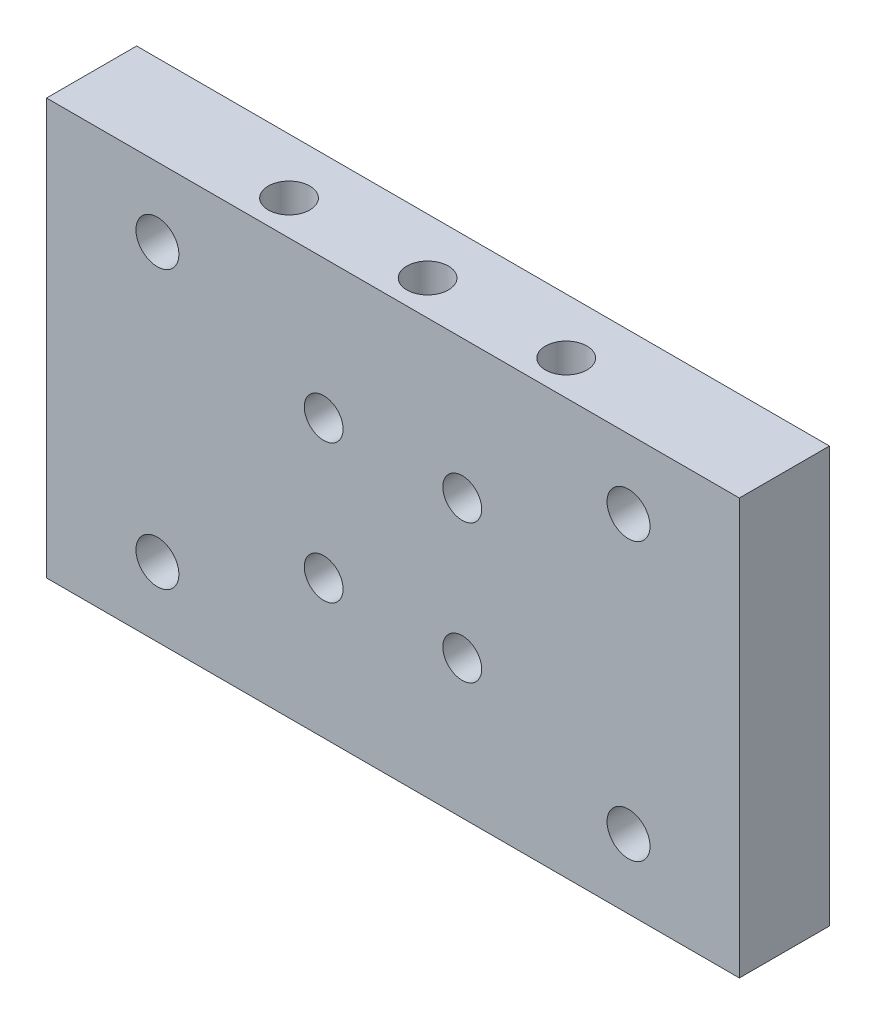
from build123d import *

# Parameters (mm, degrees)
SKETCH_1_W          = 50
SKETCH_1_H          = 30
EXTRUDE_1_DEPTH     = 6.5
SKETCH_2_R          = 1.4
CUT_EXTRUDE_1_DEPTH = 30.870554062
SKETCH_4_R          = 1.55
CUT_EXTRUDE_2_DEPTH = 30.870554062
SKETCH_5_R          = 1.5
CUT_EXTRUDE_3_DEPTH = 40.588508434


with BuildPart() as part:
    # 草图1 → 凸台-拉伸1 (new body)
    with BuildSketch(Plane.XY):
        Rectangle(SKETCH_1_W, SKETCH_1_H)
    extrude(amount=EXTRUDE_1_DEPTH)

    # 草图2 → 切除-拉伸1 (cut, through all)
    with BuildSketch(Plane.XY.offset(6.5)):
        with Locations((-5, -5)):
            Circle(SKETCH_2_R)
        with Locations((5, -5)):
            Circle(SKETCH_2_R)
        with Locations((-5, 5)):
            Circle(SKETCH_2_R)
        with Locations((5, 5)):
            Circle(SKETCH_2_R)
    extrude(amount=-CUT_EXTRUDE_1_DEPTH, mode=Mode.SUBTRACT)

    # 草图4 → 切除-拉伸2 (cut, through all)
    with BuildSketch(Plane(origin=(0, 0, 0), x_dir=(-1, 0, 0), z_dir=(0, 0, -1))):
        with Locations((-17, 10)):
            Circle(SKETCH_4_R)
        with Locations((-17, -10)):
            Circle(SKETCH_4_R)
        with Locations((17, -10)):
            Circle(SKETCH_4_R)
        with Locations((17, 10)):
            Circle(SKETCH_4_R)
    extrude(amount=-CUT_EXTRUDE_2_DEPTH, mode=Mode.SUBTRACT)

    # 草图5 → 切除-拉伸3 (cut, through all)
    with BuildSketch(Plane(origin=(0, 15, 0), x_dir=(1, 0, 0), z_dir=(0, 1, 0))):
        with Locations((-10, -4)):
            Circle(SKETCH_5_R)
        with Locations((0, -4)):
            Circle(SKETCH_5_R)
        with Locations((10, -4)):
            Circle(SKETCH_5_R)
    extrude(amount=-CUT_EXTRUDE_3_DEPTH, mode=Mode.SUBTRACT)


solid = part.part
